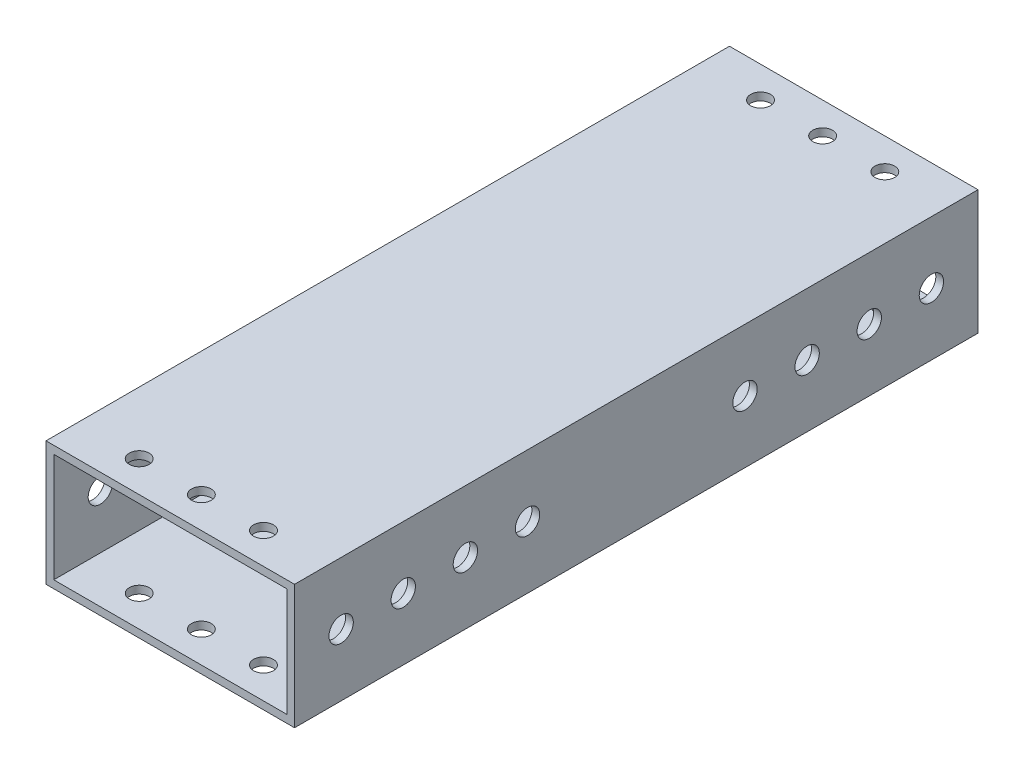
from build123d import *

# Parameters (mm, degrees)
SKETCH1_W           = 50.8
SKETCH1_H           = 25.4
SKETCH1_W_2         = 47.625
SKETCH1_H_2         = 22.225
BOSS_EXTRUDE1_DEPTH = 69.85
SKETCH2_R           = 2.0193
CUT_EXTRUDE1_DEPTH  = 79.545162168
SKETCH3_R           = 2.4892
CUT_EXTRUDE2_DEPTH  = 88.298066989


with BuildPart() as part:
    # Sketch1 → Boss-Extrude1 (new, symmetric)
    with BuildSketch(Plane.XY):
        Rectangle(SKETCH1_W, SKETCH1_H)
        Rectangle(SKETCH1_W_2, SKETCH1_H_2, mode=Mode.SUBTRACT)
    extrude(amount=BOSS_EXTRUDE1_DEPTH, both=True)

    # Sketch2 → Cut-Extrude1 (cut, through all)
    with BuildSketch(Plane(origin=(0, 12.7, 0), x_dir=(1, 0, 0), z_dir=(0, 1, 0))):
        with Locations((-12.7, 63.5)):
            Circle(SKETCH2_R)
        with Locations((0, 63.5)):
            Circle(SKETCH2_R)
        with Locations((12.7, 63.5)):
            Circle(SKETCH2_R)
        with Locations((12.7, -63.5)):
            Circle(SKETCH2_R)
        with Locations((0, -63.5)):
            Circle(SKETCH2_R)
        with Locations((-12.7, -63.5)):
            Circle(SKETCH2_R)
    extrude(amount=-CUT_EXTRUDE1_DEPTH, mode=Mode.SUBTRACT)

    # Sketch3 → Cut-Extrude2 (cut, through all)
    with BuildSketch(Plane(origin=(25.4, 0, 0), x_dir=(0, 0, -1), z_dir=(1, 0, 0))):
        with Locations((-60.325, 0)):
            Circle(SKETCH3_R)
        with Locations((60.325, 0)):
            Circle(SKETCH3_R)
        with Locations((-47.625, 0)):
            Circle(SKETCH3_R)
        with Locations((-34.925, 0)):
            Circle(SKETCH3_R)
        with Locations((34.925, 0)):
            Circle(SKETCH3_R)
        with Locations((47.625, 0)):
            Circle(SKETCH3_R)
        with Locations((-22.225, 0)):
            Circle(SKETCH3_R)
        with Locations((22.225, 0)):
            Circle(SKETCH3_R)
    extrude(amount=-CUT_EXTRUDE2_DEPTH, mode=Mode.SUBTRACT)


solid = part.part
